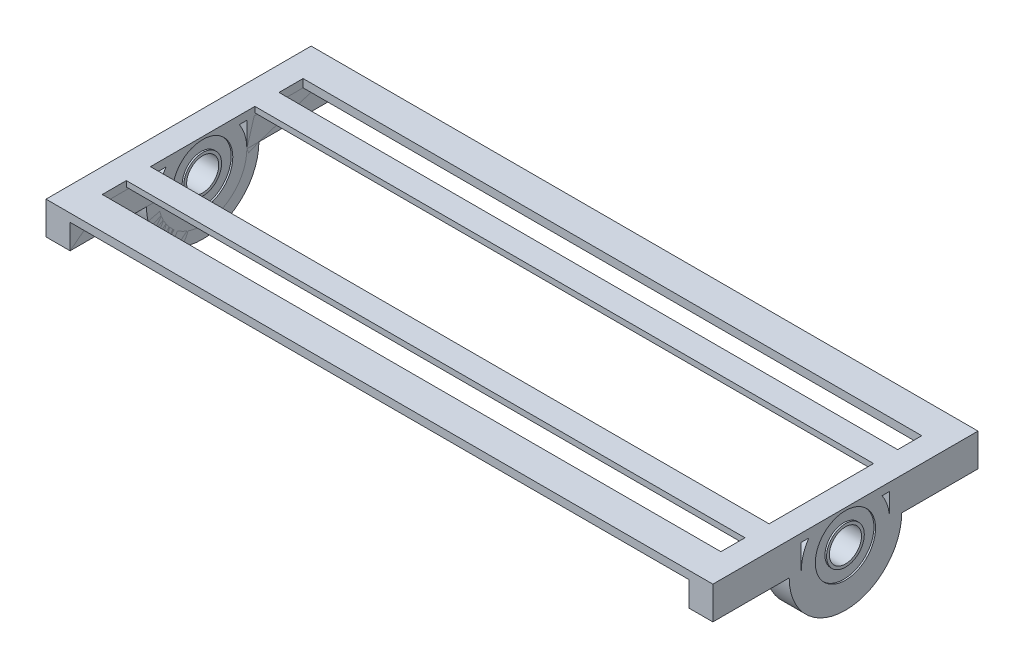
from build123d import *

# Parameters (mm, degrees)
SKETCH3_W               = 830
SKETCH3_H               = 330
SKETCH3_W_2             = 770
SKETCH3_H_2             = 250
BOSS_EXTRUDE1_DEPTH     = 10
SKETCH4_W               = 770
SKETCH4_H               = 30
BOSS_EXTRUDE2_DEPTH     = 7
BOSS_EXTRUDE4_DEPTH     = 30
LPATTERN1_COUNT         = 2
LPATTERN1_PITCH         = 800
SKETCH7_R               = 20
BOSS_EXTRUDE5_DEPTH     = 30
SKETCH9_R               = 37.5
SKETCH9_R_2             = 23.5
CUT_EXTRUDE1_DEPTH      = 2
CUT_EXTRUDE2_START      = -2
SKETCH10_R              = 37.5
SKETCH10_R_2            = 23.5
CUT_EXTRUDE2_DEPTH      = 2
LPATTERN3_START         = -415
LPATTERN3_DEPTH         = 2
LPATTERN3_START_2       = -387
LPATTERN3_2_DEPTH       = 2
LPATTERN3_START_3       = -413
LPATTERN3_3_OUTLINE_R   = 20
LPATTERN3_3_DEPTH       = 26
LPATTERN3_4_OUTLINE_R   = 23.5
LPATTERN3_4_OUTLINE_R_2 = 20
LPATTERN3_4_DEPTH       = 30


# Read off the part's stored shape, not the designer's step: LPattern3
with BuildPart() as part:
    # Sketch3 → Boss-Extrude1 (new body)
    with BuildSketch(Plane(origin=(0, 0, 0), x_dir=(1, 0, 0), z_dir=(0, 1, 0))):
        Rectangle(SKETCH3_W, SKETCH3_H)
        Rectangle(SKETCH3_W_2, SKETCH3_H_2, mode=Mode.SUBTRACT)
    extrude(amount=BOSS_EXTRUDE1_DEPTH)

    # Sketch4 → Boss-Extrude2 (add)
    with BuildSketch(Plane(origin=(0, 10, 0), x_dir=(1, 0, 0), z_dir=(0, 1, 0))):
        with Locations((0, 80)):
            Rectangle(SKETCH4_W, SKETCH4_H)
        with Locations((0, -80)):
            Rectangle(SKETCH4_W, SKETCH4_H)
    extrude(amount=-BOSS_EXTRUDE2_DEPTH)



with BuildPart() as body_2:
    # Sketch5 → Boss-Extrude4 (new body)
    with BuildSketch(Plane(origin=(415, 0, 0), x_dir=(0, 0, -1), z_dir=(1, 0, 0))):
        with BuildLine():
            ThreePointArc((55, -30.746966092), (0, -85.746966092), (-55, -30.746966092))
            Line((-55, -30.746966092), (-70, -30.746966092))
            ThreePointArc((-70, -30.746966092), (0, -100.746966092), (70, -30.746966092))
            Line((70, -30.746966092), (55, -30.746966092))
        make_face()
        Polygon((-55, 0), (-165, 0), (-165, -30.746966092), (-70, -30.746966092), (-55, -30.746966092), align=None)
        Polygon((165, 0), (55, 0), (55, -30.746966092), (70, -30.746966092), (165, -30.746966092), align=None)
    boss_extrude4 = extrude(amount=-BOSS_EXTRUDE4_DEPTH)


with BuildPart() as lpattern1_1:
    # LPattern1: Boss-Extrude4 ×2
    with Locations(*[(-i * LPATTERN1_PITCH, 0, 0) for i in range(1, LPATTERN1_COUNT)]):
        add(boss_extrude4)


with BuildPart() as part_1:
    add(part.part)

    add(body_2.part)  # Boss-Extrude5 merges body 2
    # Sketch7 → Boss-Extrude5 (add)
    with BuildSketch(Plane(origin=(415, 0, 0), x_dir=(0, 0, -1), z_dir=(1, 0, 0))):
        with BuildLine():
            Line((45.60289548, 0), (-45.60289548, 0))
            ThreePointArc((-45.60289548, 0), (0, -85.746966092), (45.60289548, 0))
        make_face()
        with Locations((0, -30.746966092)):
            Circle(SKETCH7_R, mode=Mode.SUBTRACT)
    extrude(amount=-BOSS_EXTRUDE5_DEPTH)

    # Sketch9 → Cut-Extrude1 (cut)
    with BuildSketch(Plane(origin=(415, 0, 0), x_dir=(0, 0, -1), z_dir=(1, 0, 0))):
        with Locations((0, -30.746966092)):
            Circle(SKETCH9_R)
        with Locations((0, -30.746966092)):
            Circle(SKETCH9_R_2, mode=Mode.SUBTRACT)
    extrude(amount=-CUT_EXTRUDE1_DEPTH, mode=Mode.SUBTRACT)

    # Sketch10 → Cut-Extrude2 (cut)
    with BuildSketch(Plane.ZY.offset(-385).offset(CUT_EXTRUDE2_START)):
        with Locations(Location((0, -30.746966092, 0), (0, 0, 180))):
            Circle(SKETCH10_R)
        with Locations(Location((0, -30.746966092, 0), (0, 0, 180))):
            Circle(SKETCH10_R_2, mode=Mode.SUBTRACT)
    extrude(amount=CUT_EXTRUDE2_DEPTH, mode=Mode.SUBTRACT)

    # LPattern3 outline → LPattern3 (cut)
    with BuildSketch(Plane.YZ.offset(LPATTERN3_START)):
        with BuildLine():
            ThreePointArc((0, -21.467977924), (6.753033908, 0), (0, 21.467977924))
            Line((0, 21.467977924), (0, -21.467977924))
        make_face()
    extrude(amount=LPATTERN3_DEPTH, mode=Mode.SUBTRACT)

    # LPattern3 2 outline → LPattern3 2 (cut)
    with BuildSketch(Plane.YZ.offset(LPATTERN3_START_2)):
        with BuildLine():
            ThreePointArc((0, -21.467977924), (6.753033908, 0), (0, 21.467977924))
            Line((0, 21.467977924), (0, -21.467977924))
        make_face()
    extrude(amount=LPATTERN3_2_DEPTH, mode=Mode.SUBTRACT)

    # LPattern3 3 outline → LPattern3 3 (add)
    with BuildSketch(Plane.YZ.offset(LPATTERN3_START_3)):
        with BuildLine():
            Line((-30.746966092, 165), (-30.746966092, 70))
            ThreePointArc((-30.746966092, 70), (-100.746966092, 0), (-30.746966092, -70))
            Line((-30.746966092, -70), (-30.746966092, -165))
            Line((-30.746966092, -165), (0, -165))
            Line((0, -165), (0, -55))
            Line((0, -55), (-30.746966092, -55))
            ThreePointArc((-30.746966092, -55), (-14.671507333, -52.598285387), (0, -45.60289548))
            Line((0, -45.60289548), (0, 45.60289548))
            ThreePointArc((0, 45.60289548), (-14.671507333, 52.598285387), (-30.746966092, 55))
            Line((-30.746966092, 55), (0, 55))
            Line((0, 55), (0, 165))
            Line((0, 165), (-30.746966092, 165))
        make_face()
        with Locations((-30.746966092, 0)):
            Circle(LPATTERN3_3_OUTLINE_R, mode=Mode.SUBTRACT)
    extrude(amount=LPATTERN3_3_DEPTH)

    # LPattern3 4 outline → LPattern3 4 (add)
    # profile 1 of 2: a face of its own
    with BuildSketch(Plane.YZ.offset(LPATTERN3_START)):
        with BuildLine():
            Line((-30.746966092, 165), (-30.746966092, 70))
            ThreePointArc((-30.746966092, 70), (-100.746966092, 0), (-30.746966092, -70))
            Line((-30.746966092, -70), (-30.746966092, -165))
            Line((-30.746966092, -165), (0, -165))
            Line((0, -165), (0, -55))
            Line((0, -55), (-30.746966092, -55))
            ThreePointArc((-30.746966092, -55), (-14.671507333, -52.598285387), (0, -45.60289548))
            Line((0, -45.60289548), (0, -21.467977924))
            ThreePointArc((0, -21.467977924), (-68.246966092, 0), (0, 21.467977924))
            Line((0, 21.467977924), (0, 45.60289548))
            ThreePointArc((0, 45.60289548), (-14.671507333, 52.598285387), (-30.746966092, 55))
            Line((-30.746966092, 55), (0, 55))
            Line((0, 55), (0, 165))
            Line((0, 165), (-30.746966092, 165))
        make_face()
    # profile 2 of 2: a face of its own
    with BuildSketch(Plane.YZ.offset(LPATTERN3_START)):
        with Locations((-30.746966092, 0)):
            Circle(LPATTERN3_4_OUTLINE_R)
        with Locations((-30.746966092, 0)):
            Circle(LPATTERN3_4_OUTLINE_R_2, mode=Mode.SUBTRACT)
    extrude(amount=LPATTERN3_4_DEPTH)


solid = Compound([lpattern1_1.part, part_1.part])
